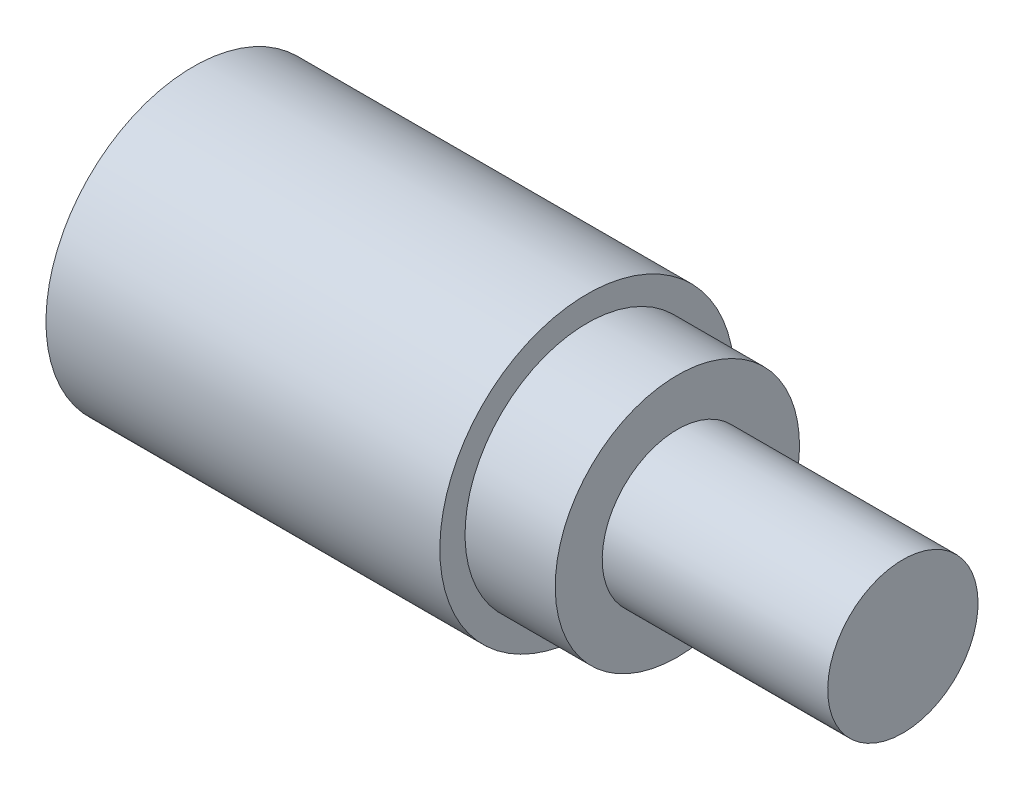
from build123d import *


with BuildPart() as part:
    # Sketch1 → Revolve1 (revolve)
    with BuildSketch(Plane.XY):
        Polygon((0, 10.31875), (-7.62, 10.31875), (-7.62, 12.446), (-40.894, 12.446), (-40.894, 0), (19.05, 0), (19.05, 6.35), (0, 6.35), align=None)
    revolve(axis=Axis((-40.894, 0, 0), (1, 0, 0)))


solid = part.part
